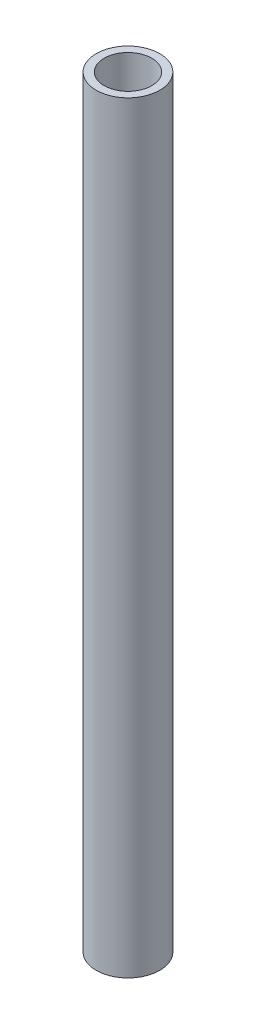
from build123d import *

# Parameters (mm, degrees)
TUBE_STOCK_EXTRUDE_DEPTH      = 152.4
TUBE_STOCK_EXTRUDE_DEPTH_BACK = 152.4
SKETCH2_R                     = 12.7
SKETCH2_R_2                   = 9.525


with BuildPart() as part:
    # Sketch2 → Tube Stock - Extrude (new, two sides: drawn at the far end of the back side and taken through both)
    with BuildSketch(Plane(origin=(0, 0, 0), x_dir=(1, 0, 0), z_dir=(0, 1, 0)).offset(-TUBE_STOCK_EXTRUDE_DEPTH_BACK)):
        Circle(SKETCH2_R)
        Circle(SKETCH2_R_2, mode=Mode.SUBTRACT)
    extrude(amount=TUBE_STOCK_EXTRUDE_DEPTH + TUBE_STOCK_EXTRUDE_DEPTH_BACK)


solid = part.part
